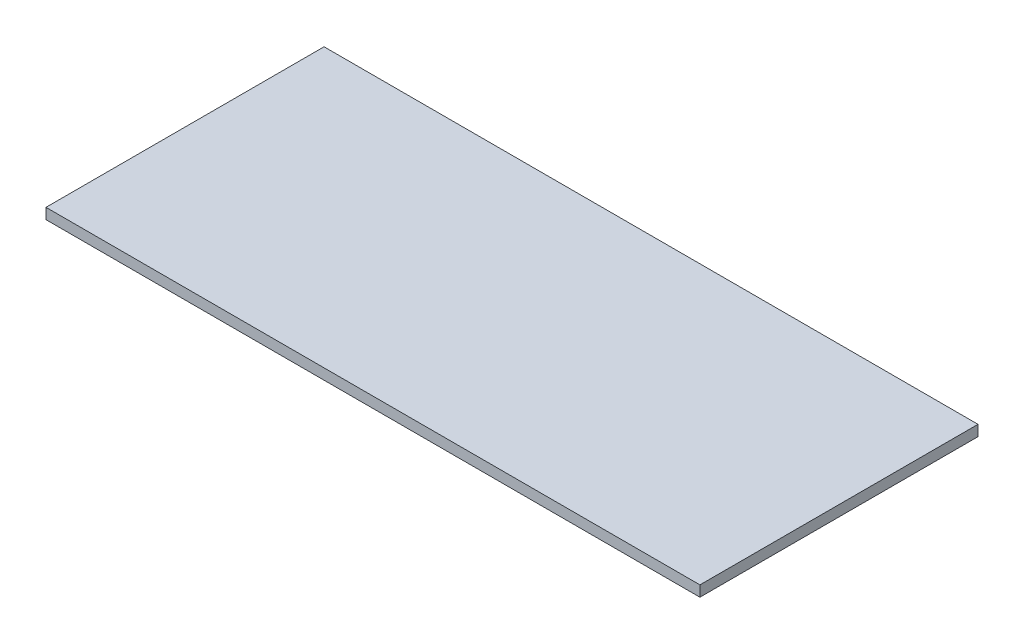
from build123d import *

# Parameters (mm, degrees)
SKETCH_2_W           = 85
SKETCH_2_H           = 40.350877193
EXTRUDE_2_DEPTH      = 4
CUT_EXTRUDE_9_DEPTH  = 2
SKETCH_4_R           = 2
CUT_EXTRUDE_13_DEPTH = 2
SKETCH_8_R           = 2
CUT_EXTRUDE_14_DEPTH = 2
SKETCH_9_R           = 1.7
CUT_EXTRUDE_15_DEPTH = 4
FILLET_6_R           = 1
FILLET_9_R           = 50
FILLET_11_R          = 1
FILLET_12_R          = 1
FILLET_13_R          = 1
FILLET_14_R          = 1
FILLET_15_R          = 1
FILLET_16_R          = 1
FILLET_17_R          = 1
FILLET_18_R          = 1
FILLET_19_R          = 1
FILLET_23_R          = 0.1
FILLET_24_R          = 0.1
FILLET_25_R          = 1
FILLET_26_R          = 1
FILLET_27_R          = 1
FILLET_28_R          = 1
SKETCH_11_W          = 122.119447846
SKETCH_11_H          = 51.930010933
EXTRUDE_4_DEPTH      = 2


with BuildPart() as part:
    # 草图2 → 凸台-拉伸2 (new body)
    with BuildSketch(Plane(origin=(0, 0, 0), x_dir=(1, 0, 0), z_dir=(0, 1, 0))):
        with Locations((-8.260233918, 7.953216375)):
            Rectangle(SKETCH_2_W, SKETCH_2_H)
    extrude(amount=EXTRUDE_2_DEPTH)

    # 草图3 → 切除-拉伸9 (cut)
    with BuildSketch(Plane(origin=(0, 0, 0), x_dir=(1, 0, 0), z_dir=(0, 1, 0))):
        with BuildLine():
            Line((7.141300063, -3.423174679), (7.141300063, 7.953075954))
            Line((7.141300063, 7.953075954), (7.141300063, 8.453075954))
            Line((7.141300063, 8.453075954), (22.939766082, 8.453075954))
            Line((22.939766082, 8.453075954), (22.939766082, 7.453075954))
            Line((22.939766082, 7.453075954), (8.332708966, 7.453075954))
            Line((8.332708966, 7.453075954), (8.141300063, 7.453075954))
            Line((8.141300063, 7.453075954), (8.141300063, -3.367226613))
            ThreePointArc((8.141300063, -3.367226613), (5.793603892, -6.117542647), (3.141300063, -3.659657378))
            Line((3.141300063, -3.659657378), (3.141300063, 19.475628159))
            ThreePointArc((3.141300063, 19.475628159), (2.684570377, 20.099991696), (2.141300063, 19.54927471))
            Line((2.141300063, 19.54927471), (2.141300063, -3.684214987))
            ThreePointArc((2.141300063, -3.684214987), (-0.360392065, -6.170265877), (-2.858699937, -3.680814068))
            Line((-2.858699937, -3.680814068), (-2.858699937, 19.54927471))
            ThreePointArc((-2.858699937, 19.54927471), (-3.358699937, 20.04927471), (-3.858699937, 19.54927471))
            Line((-3.858699937, 19.54927471), (-3.858699937, -3.868826578))
            ThreePointArc((-3.858699937, -3.868826578), (-6.45406539, -6.103506829), (-8.858699937, -3.664767327))
            Line((-8.858699937, -3.664767327), (-8.858699937, 19.475628159))
            ThreePointArc((-8.858699937, 19.475628159), (-9.315429623, 20.099991696), (-9.858699937, 19.54927471))
            Line((-9.858699937, 19.54927471), (-9.858699937, -3.977792488))
            ThreePointArc((-9.858699937, -3.977792488), (-12.347177567, -6.336059123), (-14.858699937, -4.002350096))
            Line((-14.858699937, -4.002350096), (-14.858699937, 19.484229611))
            ThreePointArc((-14.858699937, 19.484229611), (-15.297787958, 20.096444716), (-15.858699937, 19.593470188))
            Line((-15.858699937, 19.593470188), (-15.858699937, 8.453075954))
            Line((-15.858699937, 8.453075954), (-15.858699937, 7.453075954))
            Line((-15.858699937, 7.453075954), (-22.595809003, 7.453075954))
            Line((-22.595809003, 7.453075954), (-41.760233918, -2.157381342))
            Line((-41.760233918, -2.157381342), (-42.566026343, -1.44384175))
            Line((-42.566026343, -1.44384175), (-24.864828341, 7.453075954))
            Line((-24.864828341, 7.453075954), (-42.564621955, 7.453075954))
            Line((-42.564621955, 7.453075954), (-42.564621955, 8.453075954))
            Line((-42.564621955, 8.453075954), (-24.830823405, 8.453075954))
            Line((-24.830823405, 8.453075954), (-42.207658328, 17.14661392))
            Line((-42.207658328, 17.14661392), (-41.760233918, 18.040935673))
            Line((-41.760233918, 18.040935673), (-22.595809003, 8.453075954))
            Line((-22.595809003, 8.453075954), (-16.858699937, 8.453075954))
            Line((-16.858699937, 8.453075954), (-16.858699937, 19.593470188))
            ThreePointArc((-16.858699937, 19.593470188), (-15.257940096, 21.096450602), (-13.858699937, 19.404259958))
            Line((-13.858699937, 19.404259958), (-13.858699937, -3.963766104))
            ThreePointArc((-13.858699937, -3.963766104), (-12.349941217, -5.336059103), (-10.858699937, -3.944750225))
            Line((-10.858699937, -3.944750225), (-10.858699937, 19.517270996))
            ThreePointArc((-10.858699937, 19.517270996), (-9.288566003, 21.099997568), (-7.858699937, 19.38949267))
            Line((-7.858699937, 19.38949267), (-7.858699937, -3.649723614))
            ThreePointArc((-7.858699937, -3.649723614), (-6.431116121, -5.10350525), (-4.858699937, -3.807749123))
            Line((-4.858699937, -3.807749123), (-4.858699937, 19.54927471))
            ThreePointArc((-4.858699937, 19.54927471), (-3.358699937, 21.04927471), (-1.858699937, 19.54927471))
            Line((-1.858699937, 19.54927471), (-1.858699937, -3.678429695))
            ThreePointArc((-1.858699937, -3.678429695), (-0.360008779, -5.170265877), (1.141300063, -3.681064031))
            Line((1.141300063, -3.681064031), (1.141300063, 19.517270996))
            ThreePointArc((1.141300063, 19.517270996), (2.711433997, 21.099997568), (4.141300063, 19.38949267))
            Line((4.141300063, 19.38949267), (4.141300063, -3.649723614))
            ThreePointArc((4.141300063, -3.649723614), (5.760698323, -5.117541465), (7.141300063, -3.423174679))
        make_face()
    extrude(amount=CUT_EXTRUDE_9_DEPTH, mode=Mode.SUBTRACT)

    # 草图4 → 切除-拉伸13 (cut)
    with BuildSketch(Plane(origin=(0, 0, 0), x_dir=(1, 0, 0), z_dir=(0, 1, 0))):
        with Locations((-43.760233918, 18.040935673)):
            Circle(SKETCH_4_R)
        with Locations((-43.760233918, 7.953216374)):
            Circle(SKETCH_4_R)
        with Locations((-43.760233918, -2.134502924)):
            Circle(SKETCH_4_R)
    extrude(amount=CUT_EXTRUDE_13_DEPTH, mode=Mode.SUBTRACT)

    # 草图8 → 切除-拉伸14 (cut)
    with BuildSketch(Plane(origin=(0, 0, 0), x_dir=(1, 0, 0), z_dir=(0, 1, 0))):
        with Locations((24.739766082, 7.953216374)):
            Circle(SKETCH_8_R)
    extrude(amount=CUT_EXTRUDE_14_DEPTH, mode=Mode.SUBTRACT)

    # 草图9 → 切除-拉伸15 (cut)
    with BuildSketch(Plane(origin=(0, 0, 0), x_dir=(1, 0, 0), z_dir=(0, 1, 0))):
        with Locations(Location((-43.760233918, 18.040935673, 0), (0, 0, 270))):
            Circle(SKETCH_9_R)
        with Locations(Location((-43.760233918, 7.953216374, 0), (0, 0, 270))):
            Circle(SKETCH_9_R)
        with Locations(Location((-43.760233918, -2.134502924, 0), (0, 0, 270))):
            Circle(SKETCH_9_R)
        with Locations(Location((24.739766082, 7.953216374, 0), (0, 0, 270))):
            Circle(SKETCH_9_R)
    extrude(amount=CUT_EXTRUDE_15_DEPTH, mode=Mode.SUBTRACT)

    # 圆角6
    fillet_6_edges = [part.edges().sort_by_distance(p)[0] for p in [
        (-42.010998928, 1, 1.164875703),
    ]]
    fillet(fillet_6_edges, radius=FILLET_6_R)

    # 圆角9
    # the kernel refuses this fillet: 50 mm, written as the material it adds along each edge
    with BuildSketch(Plane(origin=(-41.760233918, 0, 2.157381342), x_dir=(-0.7486630061639391, 0, -0.6629507547333918), z_dir=(0, 1, 0))) as fillet_9_piece_1:
        with BuildLine():
            CenterArc((46.363497209, -18.720100753), FILLET_9_R, 158.012641456, 0.145228932)
            Line((-0.047128239, -0.117578196), (0, 0))
            Line((0, 0), (0.000173043, 0))
        make_face()
    extrude(amount=2.316679088)

    # 圆角11
    fillet_11_edges = [part.edges().sort_by_distance(p)[0] for p in [
        (-41.760363469, 1, 2.157266623),
    ]]
    fillet(fillet_11_edges, radius=FILLET_11_R)

    # 圆角12
    fillet_12_edges = [part.edges().sort_by_distance(p)[0] for p in [
        (22.80331067, 1, -7.453075954),
    ]]
    fillet(fillet_12_edges, radius=FILLET_12_R)

    # 圆角13
    fillet_13_edges = [part.edges().sort_by_distance(p)[0] for p in [
        (22.803238158, 1, -8.453075954),
    ]]
    fillet(fillet_13_edges, radius=FILLET_13_R)

    # 圆角14
    fillet_14_edges = [part.edges().sort_by_distance(p)[0] for p in [
        (8.141300063, 1, -7.453075954),
    ]]
    fillet(fillet_14_edges, radius=FILLET_14_R)

    # 圆角15
    fillet_15_edges = [part.edges().sort_by_distance(p)[0] for p in [
        (7.141300063, 1, -8.453075954),
    ]]
    fillet(fillet_15_edges, radius=FILLET_15_R)

    # 圆角16
    fillet_16_edges = [part.edges().sort_by_distance(p)[0] for p in [
        (-16.858699937, 1, -8.453075954),
    ]]
    fillet(fillet_16_edges, radius=FILLET_16_R)

    # 圆角17
    fillet_17_edges = [part.edges().sort_by_distance(p)[0] for p in [
        (-15.858699937, 1, -7.453075954),
    ]]
    fillet(fillet_17_edges, radius=FILLET_17_R)

    # 圆角18
    fillet_18_edges = [part.edges().sort_by_distance(p)[0] for p in [
        (-22.595809003, 1, -8.453075954),
    ]]
    fillet(fillet_18_edges, radius=FILLET_18_R)

    # 圆角19
    fillet_19_edges = [part.edges().sort_by_distance(p)[0] for p in [
        (-22.595809003, 1, -7.453075954),
    ]]
    fillet(fillet_19_edges, radius=FILLET_19_R)

    # 圆角23
    fillet_23_edges = [part.edges().sort_by_distance(p)[0] for p in [
        (-24.864828341, 1, -7.453075954),
    ]]
    fillet(fillet_23_edges, radius=FILLET_23_R)

    # 圆角24
    fillet_24_edges = [part.edges().sort_by_distance(p)[0] for p in [
        (-24.830823405, 1, -8.453075954),
    ]]
    fillet(fillet_24_edges, radius=FILLET_24_R)

    # 圆角25
    fillet_25_edges = [part.edges().sort_by_distance(p)[0] for p in [
        (-41.760233918, 1, -18.040935673),
    ]]
    fillet(fillet_25_edges, radius=FILLET_25_R)

    # 圆角26
    fillet_26_edges = [part.edges().sort_by_distance(p)[0] for p in [
        (-42.021111406, 1, -17.053285488),
    ]]
    fillet(fillet_26_edges, radius=FILLET_26_R)

    # 圆角27
    fillet_27_edges = [part.edges().sort_by_distance(p)[0] for p in [
        (-41.823705994, 1, -8.453075954),
    ]]
    fillet(fillet_27_edges, radius=FILLET_27_R)

    # 圆角28
    fillet_28_edges = [part.edges().sort_by_distance(p)[0] for p in [
        (-41.823778507, 1, -7.453075954),
    ]]
    fillet(fillet_28_edges, radius=FILLET_28_R)


with BuildPart() as body_2:
    # 草图11 → 凸台-拉伸4 (new body)
    with BuildSketch(Plane(origin=(0, 4, 0), x_dir=(1, 0, 0), z_dir=(0, 1, 0))):
        with Locations((-8.260233918, 7.953216375)):
            Rectangle(SKETCH_11_W, SKETCH_11_H)
    extrude(amount=EXTRUDE_4_DEPTH)


solid = Compound([part.part, body_2.part])
